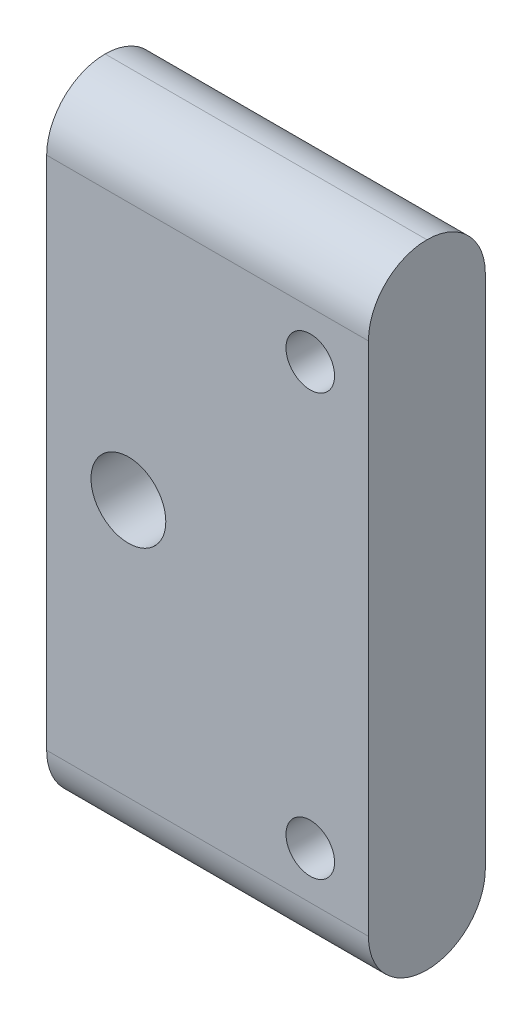
from build123d import *

# Parameters (mm, degrees)
SKETCH1_R      = 3.3000188
SKETCH1_R_2    = 5.08
EXTRUDE1_DEPTH = 15.875
FILLET1_R      = 7.9375


with BuildPart() as part:
    # Sketch1 → Extrude1 (new body)
    with BuildSketch(Plane.XY):
        Polygon((174.8183702, 88.3592086), (131.1183814, 88.3896378), (131.1183814, 174.2591892), (174.8183702, 174.2591892), align=None)
        with Locations((166.9183606, 159.9092052)):
            Circle(SKETCH1_R, mode=Mode.SUBTRACT)
        with Locations((166.9183606, 102.7091926)):
            Circle(SKETCH1_R, mode=Mode.SUBTRACT)
        with Locations((142.2181814, 131.3091862)):
            Circle(SKETCH1_R_2, mode=Mode.SUBTRACT)
    extrude(amount=-EXTRUDE1_DEPTH)

    # Fillet1
    fillet1_edges = [part.edges().sort_by_distance(p)[0] for p in [
        (152.9683758, 88.3744232, -15.875),
        (152.9683758, 88.3744232, 0),
        (152.9683758, 174.2591892, -15.875),
        (152.9683758, 174.2591892, 0),
    ]]
    fillet(fillet1_edges, radius=FILLET1_R - 0.0001)  # a hair under: the kernel refuses the full size


solid = part.part
